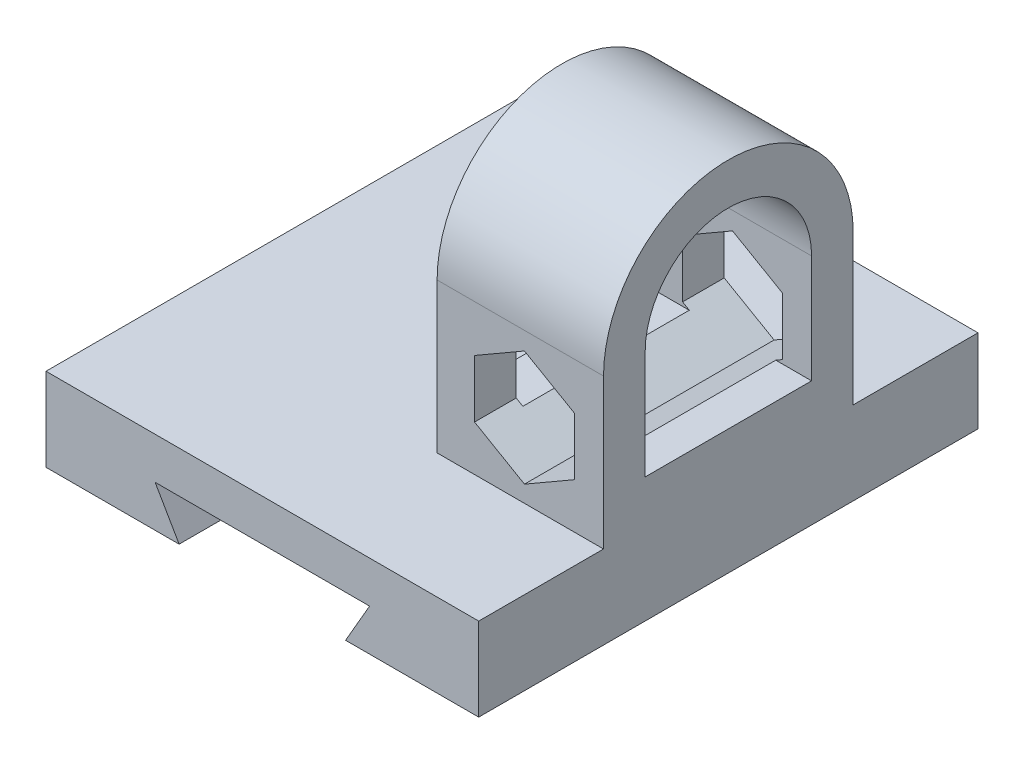
from build123d import *

# Parameters (mm, degrees)
EXTRUDE_2_DEPTH     = 30
EXTRUDE_START       = -20
EXTRUDE_1_DEPTH     = 20
CUT_EXTRUDE_1_REACH = 59.671


# Read off the part's stored shape, not the designer's step: 拉伸-薄壁1
with BuildPart() as part:
    # 草图1 → 凸台-拉伸2 (new, symmetric)
    with BuildSketch(Plane.XY):
        Polygon((-26, 5), (26, 5), (26, -5), (10, -5), (12.886751346, 0), (-12.886751346, 0), (-10, -5), (-26, -5), align=None)
    extrude(amount=EXTRUDE_2_DEPTH, both=True)

    # 拉伸-薄壁1 outline → 拉伸-薄壁1 (add)
    with BuildSketch(Plane(origin=(26, 0, 0), x_dir=(0, 0, -1), z_dir=(1, 0, 0)).offset(EXTRUDE_START)):
        with BuildLine():
            Line((15, 5), (15, 23))
            ThreePointArc((15, 23), (0, 38), (-15, 23))
            Line((-15, 23), (-15, 5))
            Line((-15, 5), (15, 5))
        make_face()
        with BuildLine():
            ThreePointArc((-10, 23), (0, 33), (10, 23))
            Line((10, 23), (10, 10))
            Line((10, 10), (-10, 10))
            Line((-10, 10), (-10, 23))
        make_face(mode=Mode.SUBTRACT)
    extrude(amount=EXTRUDE_1_DEPTH)

    # 草图6 → 切除-拉伸1 (cut, up to next)
    with BuildSketch(Plane(origin=(0, 20, 15), x_dir=(1, 0, 0), z_dir=(0, 0, 1)), mode=Mode.PRIVATE) as cut_extrude_1_sk1:
        Polygon((22.5, -2.607695155), (16.5, 0.856406461), (10.5, -2.607695155), (10.5, -9.535898385), (16.5, -13), (22.5, -9.535898385), align=None)
    cut_extrude_1_tool1 = extrude(cut_extrude_1_sk1.sketch, amount=-CUT_EXTRUDE_1_REACH, mode=Mode.PRIVATE) & part.part
    add(cut_extrude_1_tool1.solids().sort_by_distance((16.5, 13.928203, 15))[0], mode=Mode.SUBTRACT)


solid = part.part
